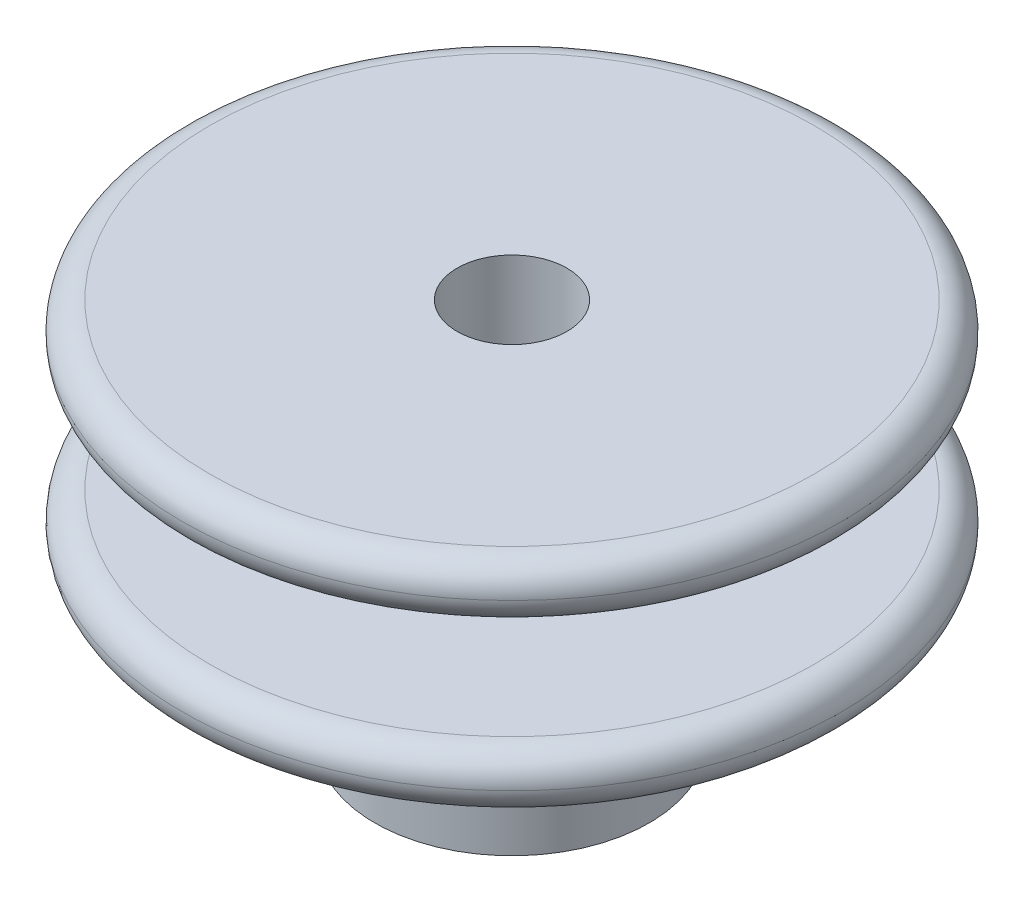
from build123d import *

# Parameters (mm, degrees)
SKETCH_1_R          = 5
EXTRUDE_1_DEPTH     = 4
SKETCH_2_R          = 12
EXTRUDE_2_DEPTH     = 2
EXTRUDE_START       = 2
SKETCH_3_R          = 12
EXTRUDE_3_DEPTH     = 2
EXTRUDE_START_2     = 6
SKETCH_4_R          = 5
EXTRUDE_4_DEPTH     = 6
SKETCH_5_R          = 2
CUT_EXTRUDE_1_DEPTH = 23
FILLET_2_R          = 1


with BuildPart() as part:
    # 草图1 → 凸台-拉伸1 (new body)
    with BuildSketch(Plane(origin=(0, 0, 0), x_dir=(1, 0, 0), z_dir=(0, 1, 0))):
        with Locations(Location((0, 0, 0), (0, 0, 270))):
            Circle(SKETCH_1_R)
    extrude(amount=EXTRUDE_1_DEPTH)

    # 草图2 → 凸台-拉伸2 (add)
    with BuildSketch(Plane(origin=(0, 4, 0), x_dir=(1, 0, 0), z_dir=(0, 1, 0))):
        with Locations(Location((0, 0, 0), (0, 0, 270))):
            Circle(SKETCH_2_R)
    extrude(amount=EXTRUDE_2_DEPTH)

    # 草图3 → 凸台-拉伸3 (add)
    with BuildSketch(Plane.XZ.offset(EXTRUDE_START)):
        with Locations(Location((0, 0, 0), (0, 0, 90))):
            Circle(SKETCH_3_R)
    extrude(amount=-EXTRUDE_3_DEPTH)

    # 草图4 → 凸台-拉伸4 (add)
    with BuildSketch(Plane(origin=(0, -2, 0), x_dir=(-1, 0, 0), z_dir=(0, -1, 0)).offset(EXTRUDE_START_2)):
        with Locations(Location((0, 0, 0), (0, 0, 270))):
            Circle(SKETCH_4_R)
    extrude(amount=-EXTRUDE_4_DEPTH)

    # 草图5 → 切除-拉伸1 (cut, through all)
    with BuildSketch(Plane.XZ.offset(8)):
        with Locations(Location((0, 0, 0), (0, 0, 270))):
            Circle(SKETCH_5_R)
    extrude(amount=-CUT_EXTRUDE_1_DEPTH, mode=Mode.SUBTRACT)

    # 圆角2
    fillet_2_edges = [part.edges().sort_by_distance(p)[0] for p in [
        (0, -2, -12),
        (0, 4, -12),
        (0, 6, -12),
        (0, 0, -12),
    ]]
    fillet(fillet_2_edges, radius=FILLET_2_R - 0.0001)  # a hair under: the kernel refuses the full size


solid = part.part
